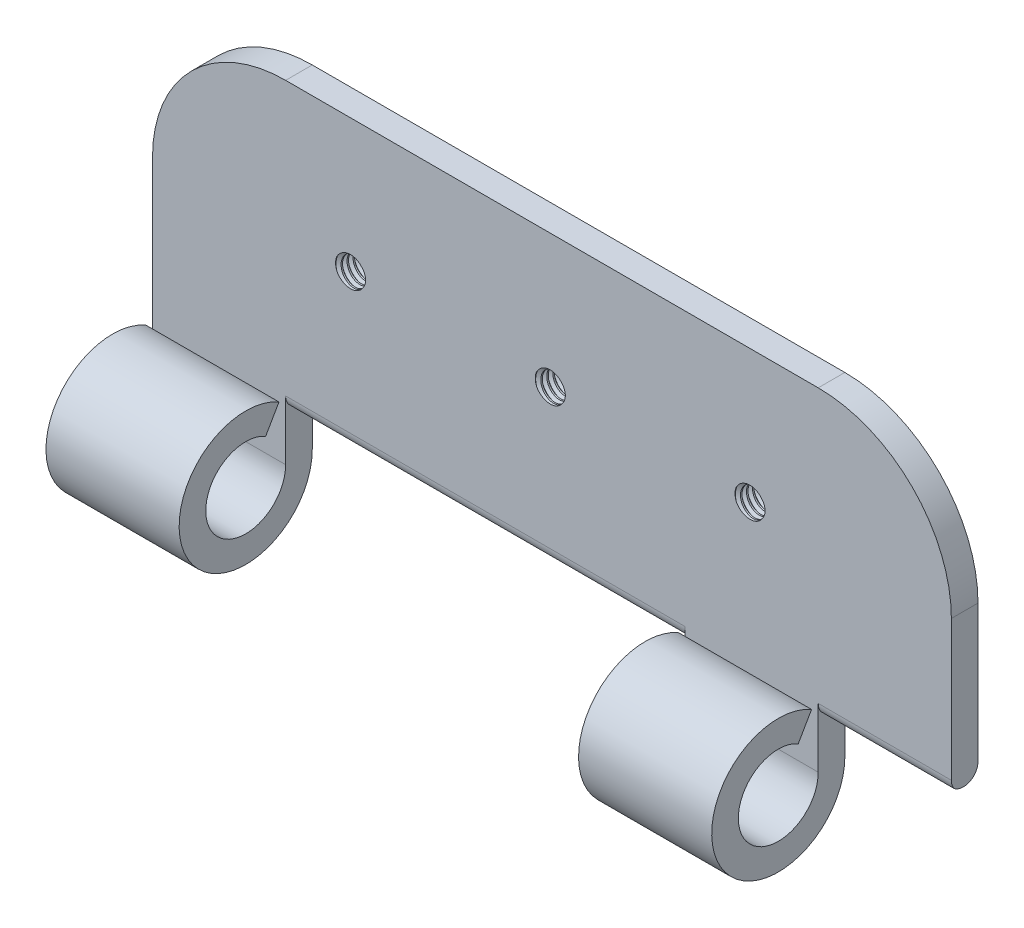
from build123d import *

# Parameters (mm, degrees)
SKETCH1_W           = 60
SKETCH1_H           = 50
BOSS_EXTRUDE1_DEPTH = 2
BOSS_EXTRUDE2_DEPTH = 10
BOSS_EXTRUDE3_DEPTH = 10
SKETCH8_R           = 5
CUT_EXTRUDE2_DEPTH  = 30
CUT_EXTRUDE3_START  = -10
SKETCH5_R           = 5
CUT_EXTRUDE3_DEPTH  = 10
FILLET1_START       = -20
FILLET1_DEPTH       = 30
FILLET1_START_2     = 20
FILLET1_2_DEPTH     = 11
FILLET3_R           = 1.1
SKETCH18_W          = 60
SKETCH18_H          = 25
CUT_EXTRUDE4_DEPTH  = 10
FILLET4_R           = 10
SKETCH19_R          = 1.25
CUT_EXTRUDE5_DEPTH  = 10
THREAD1_PITCH       = 0.45
THREAD1_TO          = 2
THREAD2_PITCH       = 0.45
THREAD2_TO          = 2
THREAD3_PITCH       = 0.45
THREAD3_TO          = 2


with BuildPart() as part:
    # Sketch1 → Boss-Extrude1 (new body)
    with BuildSketch(Plane.XY):
        Rectangle(SKETCH1_W, SKETCH1_H)
    extrude(amount=BOSS_EXTRUDE1_DEPTH)

    # Sketch2 → Boss-Extrude2 (add)
    with BuildSketch(Plane.ZY.offset(30)):
        with BuildLine():
            Line((2, -25), (0, -25))
            ThreePointArc((0, -25), (9.330127019, -27.5), (2.5, -20.669872981))
            Line((2.5, -20.669872981), (3.5, -22.401923789))
            ThreePointArc((3.5, -22.401923789), (7.598076211, -26.5), (2, -25))
        make_face()
    extrude(amount=-BOSS_EXTRUDE2_DEPTH)

    # Sketch7 → Boss-Extrude3 (add)
    with BuildSketch(Plane(origin=(10, 0, -10), x_dir=(0, 0, 1), z_dir=(-1, 0, 0))):
        with BuildLine():
            ThreePointArc((13.5, -22.401923789), (17.598076211, -26.5), (12, -25))
            Line((12, -25), (10, -25))
            ThreePointArc((10, -25), (15, -30), (20, -25))
            ThreePointArc((20, -25), (17.5, -20.669872981), (12.5, -20.669872981))
            Line((12.5, -20.669872981), (13.5, -22.401923789))
        make_face()
    extrude(amount=-BOSS_EXTRUDE3_DEPTH)

    # Sketch8 → Cut-Extrude2 (cut)
    with BuildSketch(Plane(origin=(-20, 0, 0), x_dir=(0, 0, -1), z_dir=(1, 0, 0))):
        with Locations((-5, -25)):
            Circle(SKETCH8_R)
    extrude(amount=CUT_EXTRUDE2_DEPTH, mode=Mode.SUBTRACT)

    # Sketch5 → Cut-Extrude3 (cut)
    with BuildSketch(Plane(origin=(30, 0, 0), x_dir=(0, 0, -1), z_dir=(1, 0, 0)).offset(CUT_EXTRUDE3_START)):
        with Locations((-5, -25)):
            Circle(SKETCH5_R)
    extrude(amount=CUT_EXTRUDE3_DEPTH, mode=Mode.SUBTRACT)

    # Fillet1: read off the stored shape, not the designer's step
    # Fillet1 outline → Fillet1 (cut)
    with BuildSketch(Plane.YZ.offset(FILLET1_START)):
        with BuildLine():
            ThreePointArc((-20.30958424, 0), (-21.305477447, 0.632884681), (-21.155396918, 1.803278689))
            ThreePointArc((-21.155396918, 1.803278689), (-22.87674855, 0.473212698), (-25, 0))
            Line((-25, 0), (-20.30958424, 0))
        make_face()
    extrude(amount=FILLET1_DEPTH, mode=Mode.SUBTRACT)

    # Fillet1 2 outline → Fillet1 2 (cut)
    with BuildSketch(Plane.YZ.offset(FILLET1_START_2)):
        with BuildLine():
            ThreePointArc((-20.30958424, 0), (-21.305477447, 0.632884681), (-21.155396918, 1.803278689))
            ThreePointArc((-21.155396918, 1.803278689), (-22.87674855, 0.473212698), (-25, 0))
            Line((-25, 0), (-20.30958424, 0))
        make_face()
    extrude(amount=FILLET1_2_DEPTH, mode=Mode.SUBTRACT)

    # Fillet3
    # the kernel refuses this fillet: 1.1 mm, written as the material it takes off along each edge
    with BuildSketch(Plane(origin=(31.180917646, -21, 2), x_dir=(0, 1, 0), z_dir=(-1, 0, 0))) as fillet3_piece_1:
        with BuildLine():
            CenterArc((0.472367058, 1.1), FILLET3_R, 235.201328768, 34.798671232)
            Line((-0.155396918, 0.196721311), (-0.167952198, 0.178655737))
            ThreePointArc((-0.167952198, 0.178655737), (-0.093728896, 0.085697663), (-0.0176, -0.0132))
            Line((-0.0176, -0.0132), (0, -0.022))
            Line((0, -0.022), (0.472367058, -0.022))
            Line((0.472367058, -0.022), (0.472367058, 0))
        make_face()
    extrude(amount=11.180917646, mode=Mode.SUBTRACT)
    with BuildSketch(Plane(origin=(10, -21, 2), x_dir=(0, 1, 0), z_dir=(-1, 0, 0))) as fillet3_piece_2:
        with BuildLine():
            CenterArc((0.472367058, 1.1), FILLET3_R, 235.201328768, 34.798671232)
            Line((-0.155396918, 0.196721311), (-0.167952198, 0.178655737))
            ThreePointArc((-0.167952198, 0.178655737), (-0.093728896, 0.085697663), (-0.0176, -0.0132))
            Line((-0.0176, -0.0132), (0, -0.022))
            Line((0, -0.022), (0.472367058, -0.022))
            Line((0.472367058, -0.022), (0.472367058, 0))
        make_face()
    extrude(amount=30, mode=Mode.SUBTRACT)

    # Sketch18 → Cut-Extrude4 (cut)
    with BuildSketch(Plane.XY.offset(2)):
        with Locations((0, 12.5)):
            Rectangle(SKETCH18_W, SKETCH18_H)
    extrude(amount=-CUT_EXTRUDE4_DEPTH, mode=Mode.SUBTRACT)

    # Fillet4
    fillet4_edges = [part.edges().sort_by_distance(p)[0] for p in [
        (-30, 0, 1),
        (30, 0, 1),
    ]]
    fillet(fillet4_edges, radius=FILLET4_R)

    # Sketch19 → Cut-Extrude5 (cut)
    with BuildSketch(Plane.XY.offset(2)):
        with Locations((-15, -10)):
            Circle(SKETCH19_R)
        with Locations((0, -10)):
            Circle(SKETCH19_R)
        with Locations((15, -10)):
            Circle(SKETCH19_R)
    extrude(amount=-CUT_EXTRUDE5_DEPTH, mode=Mode.SUBTRACT)

    # Thread1: arcs per turn and ends read off the stored shape
    # Thread1: the profile of Thread Profile1 profile screwed along a right-hand helix through 10 turns, 6 arcs to a turn; built about Z, then put on its axis
    thread1_z = Axis((0, 0, 0), (0, 0, 1))
    thread1_corners = [(1.2503, 0, -0.000173205), (1.2503, 0, 0.393923204), (1.006430356, 0, 0.253124999), (1.006430356, 0, 0.140624999)]
    with BuildLine(mode=Mode.PRIVATE) as thread1_profile:
        Line(thread1_corners[0], thread1_corners[1])
        Line(thread1_corners[1], thread1_corners[2])
        Line(thread1_corners[2], thread1_corners[3])
        Line(thread1_corners[3], thread1_corners[0])
    thread1_cap = Face(thread1_profile.wire())
    thread1_turn_angles = [0, 30, 60, 90, 120, 150, 180, 210, 240, 270, 300, 330, 360]
    thread1_turn_weights = [1, 0.8660254037844387, 1, 0.8660254037844387, 1, 0.8660254037844387, 1, 0.8660254037844387, 1, 0.8660254037844387, 1, 0.8660254037844387, 1]
    thread1_turn_rails = [Edge.make_bspline([Vector(p[0], p[1], 0).rotate(thread1_z, thread1_turn_angles[k]) / thread1_turn_weights[k] + Vector(0, 0, p[2] + THREAD1_PITCH * thread1_turn_angles[k] / 360) for k in range(13)], [0, 0, 0, 1, 1, 2, 2, 3, 3, 4, 4, 5, 5, 6, 6, 6], 2, thread1_turn_weights) for p in thread1_corners]
    thread1_turn_sides = [Face.make_surface_from_curves(thread1_turn_rails[p[0]], thread1_turn_rails[p[1]]) for p in [(0, 1), (1, 2), (2, 3), (3, 0)]]
    thread1 = Plane(origin=(-15, -10, 0), x_dir=(1, 0, 0), z_dir=(0, 0, 1)) * split(Solid(Shell([*[p.moved(Location((0, 0, THREAD1_PITCH * i))) for i in range(10) for p in thread1_turn_sides], thread1_cap, thread1_cap.rotate(thread1_z, 3600).moved(Location((0, 0, THREAD1_PITCH * 3600 / 360)))])), bisect_by=Plane.XY.offset(THREAD1_TO), keep=Keep.BOTTOM, mode=Mode.PRIVATE)
    add(thread1)

    # Thread2: arcs per turn and ends read off the stored shape
    # Thread2: the profile of Thread Profile2 profile screwed along a right-hand helix through 10 turns, 6 arcs to a turn; built about Z, then put on its axis
    thread2_z = Axis((0, 0, 0), (0, 0, 1))
    thread2_corners = [(1.2503, 0, -0.000173205), (1.2503, 0, 0.393923204), (1.006430356, 0, 0.253124999), (1.006430356, 0, 0.140624999)]
    with BuildLine(mode=Mode.PRIVATE) as thread2_profile:
        Line(thread2_corners[0], thread2_corners[1])
        Line(thread2_corners[1], thread2_corners[2])
        Line(thread2_corners[2], thread2_corners[3])
        Line(thread2_corners[3], thread2_corners[0])
    thread2_cap = Face(thread2_profile.wire())
    thread2_turn_angles = [0, 30, 60, 90, 120, 150, 180, 210, 240, 270, 300, 330, 360]
    thread2_turn_weights = [1, 0.8660254037844387, 1, 0.8660254037844387, 1, 0.8660254037844387, 1, 0.8660254037844387, 1, 0.8660254037844387, 1, 0.8660254037844387, 1]
    thread2_turn_rails = [Edge.make_bspline([Vector(p[0], p[1], 0).rotate(thread2_z, thread2_turn_angles[k]) / thread2_turn_weights[k] + Vector(0, 0, p[2] + THREAD2_PITCH * thread2_turn_angles[k] / 360) for k in range(13)], [0, 0, 0, 1, 1, 2, 2, 3, 3, 4, 4, 5, 5, 6, 6, 6], 2, thread2_turn_weights) for p in thread2_corners]
    thread2_turn_sides = [Face.make_surface_from_curves(thread2_turn_rails[p[0]], thread2_turn_rails[p[1]]) for p in [(0, 1), (1, 2), (2, 3), (3, 0)]]
    thread2 = Plane(origin=(0, -10, 0), x_dir=(1, 0, 0), z_dir=(0, 0, 1)) * split(Solid(Shell([*[p.moved(Location((0, 0, THREAD2_PITCH * i))) for i in range(10) for p in thread2_turn_sides], thread2_cap, thread2_cap.rotate(thread2_z, 3600).moved(Location((0, 0, THREAD2_PITCH * 3600 / 360)))])), bisect_by=Plane.XY.offset(THREAD2_TO), keep=Keep.BOTTOM, mode=Mode.PRIVATE)
    add(thread2)

    # Thread3: arcs per turn and ends read off the stored shape
    # Thread3: the profile of Thread Profile3 profile screwed along a right-hand helix through 10 turns, 6 arcs to a turn; built about Z, then put on its axis
    thread3_z = Axis((0, 0, 0), (0, 0, 1))
    thread3_corners = [(1.2503, 0, -0.000173205), (1.2503, 0, 0.393923204), (1.006430356, 0, 0.253124999), (1.006430356, 0, 0.140624999)]
    with BuildLine(mode=Mode.PRIVATE) as thread3_profile:
        Line(thread3_corners[0], thread3_corners[1])
        Line(thread3_corners[1], thread3_corners[2])
        Line(thread3_corners[2], thread3_corners[3])
        Line(thread3_corners[3], thread3_corners[0])
    thread3_cap = Face(thread3_profile.wire())
    thread3_turn_angles = [0, 30, 60, 90, 120, 150, 180, 210, 240, 270, 300, 330, 360]
    thread3_turn_weights = [1, 0.8660254037844387, 1, 0.8660254037844387, 1, 0.8660254037844387, 1, 0.8660254037844387, 1, 0.8660254037844387, 1, 0.8660254037844387, 1]
    thread3_turn_rails = [Edge.make_bspline([Vector(p[0], p[1], 0).rotate(thread3_z, thread3_turn_angles[k]) / thread3_turn_weights[k] + Vector(0, 0, p[2] + THREAD3_PITCH * thread3_turn_angles[k] / 360) for k in range(13)], [0, 0, 0, 1, 1, 2, 2, 3, 3, 4, 4, 5, 5, 6, 6, 6], 2, thread3_turn_weights) for p in thread3_corners]
    thread3_turn_sides = [Face.make_surface_from_curves(thread3_turn_rails[p[0]], thread3_turn_rails[p[1]]) for p in [(0, 1), (1, 2), (2, 3), (3, 0)]]
    thread3 = Plane(origin=(15, -10, 0), x_dir=(1, 0, 0), z_dir=(0, 0, 1)) * split(Solid(Shell([*[p.moved(Location((0, 0, THREAD3_PITCH * i))) for i in range(10) for p in thread3_turn_sides], thread3_cap, thread3_cap.rotate(thread3_z, 3600).moved(Location((0, 0, THREAD3_PITCH * 3600 / 360)))])), bisect_by=Plane.XY.offset(THREAD3_TO), keep=Keep.BOTTOM, mode=Mode.PRIVATE)
    add(thread3)


solid = part.part
